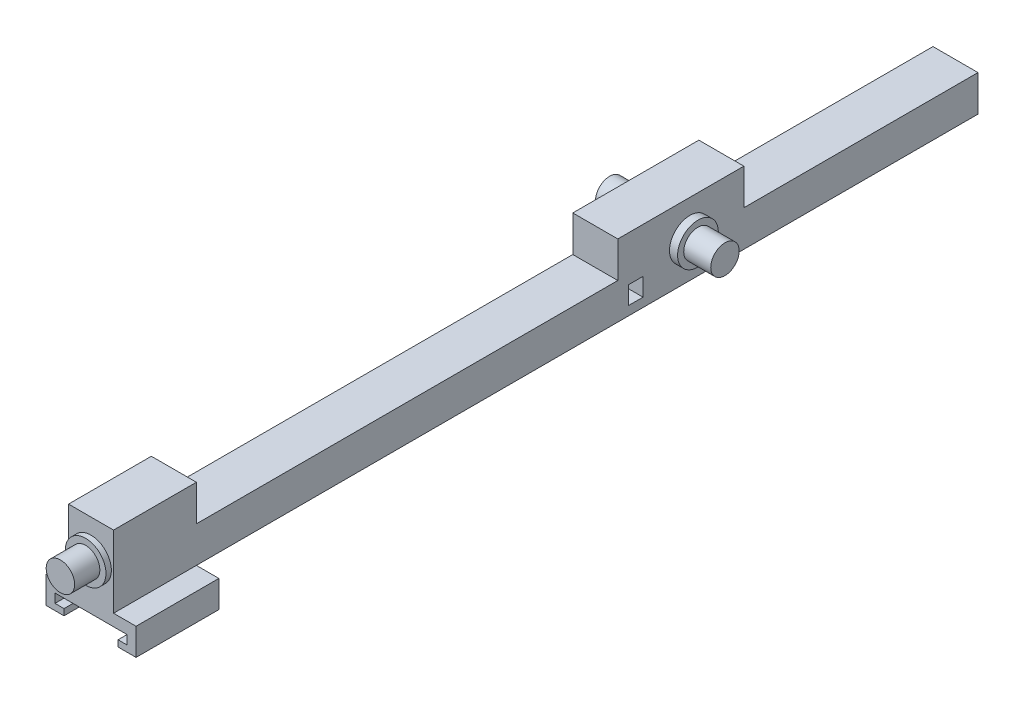
from build123d import *

# Parameters (mm, degrees)
BOSS_EXTRUDE1_DEPTH = 20
SKETCH2_R           = 5.65
BOSS_EXTRUDE2_DEPTH = 1.5
SKETCH3_R           = 3.95
BOSS_EXTRUDE3_DEPTH = 7
SKETCH4_R           = 5.65
BOSS_EXTRUDE4_DEPTH = 2.25
SKETCH5_R           = 3.95
BOSS_EXTRUDE5_DEPTH = 7.5
SKETCH9_W           = 25
SKETCH9_H           = 7.5
BOSS_EXTRUDE8_DEPTH = 23
CUT_EXTRUDE1_DEPTH  = 20
CUT_EXTRUDE2_REACH  = 173.135
SKETCH12_W          = 4
SKETCH12_H          = 5
CUT_EXTRUDE3_REACH  = 173.135
SKETCH14_W          = 65
SKETCH14_H          = 10
SKETCH14_W_2        = 117


with BuildPart() as part:
    # Sketch1 → Boss-Extrude1 (new body)
    with BuildSketch(Plane(origin=(0, 0, 0), x_dir=(1, 0, 0), z_dir=(0, 1, 0))):
        Polygon((-6.25, 80), (6.25, 80), (6.25, 0), (6.25, -160), (-6.25, -160), align=None)
    extrude(amount=BOSS_EXTRUDE1_DEPTH)

    # Sketch2 → Boss-Extrude2 (add)
    with BuildSketch(Plane.XY.offset(160)):
        with Locations((0, 10)):
            Circle(SKETCH2_R)
    extrude(amount=BOSS_EXTRUDE2_DEPTH)

    # Sketch3 → Boss-Extrude3 (add)
    with BuildSketch(Plane.XY.offset(161.5)):
        with Locations((0, 10)):
            Circle(SKETCH3_R)
    extrude(amount=BOSS_EXTRUDE3_DEPTH)

    # Sketch4 → Boss-Extrude4 (add)
    with BuildSketch(Plane.ZY.offset(6.25)):
        with Locations((0, 10)):
            Circle(SKETCH4_R)
    boss_extrude4 = extrude(amount=BOSS_EXTRUDE4_DEPTH)

    # Sketch5 → Boss-Extrude5 (add)
    with BuildSketch(Plane.ZY.offset(8.5)):
        with Locations((0, 10)):
            Circle(SKETCH5_R)
    boss_extrude5 = extrude(amount=BOSS_EXTRUDE5_DEPTH)

    # Mirror1: Boss-Extrude4, Boss-Extrude5 across plane
    add(boss_extrude4.mirror(Plane(origin=(0, 0, 0), x_dir=(0, 0, 1), z_dir=(1, 0, 0))))
    add(boss_extrude5.mirror(Plane(origin=(0, 0, 0), x_dir=(0, 0, 1), z_dir=(1, 0, 0))))

    # Sketch9 → Boss-Extrude8 (add)
    with BuildSketch(Plane.XY.offset(160)):
        with Locations((0, -3.75)):
            Rectangle(SKETCH9_W, SKETCH9_H)
    extrude(amount=-BOSS_EXTRUDE8_DEPTH)

    # Sketch10 → Cut-Extrude1 (cut)
    with BuildSketch(Plane.XY.offset(160)):
        Polygon((-10, -5.75), (-10, -3.25), (10, -3.25), (10, -5.75), (7.5, -5.75), (7.5, -7.5), (-7.5, -7.5), (-7.5, -5.75), align=None)
    extrude(amount=-CUT_EXTRUDE1_DEPTH, mode=Mode.SUBTRACT)

    # Sketch12 → Cut-Extrude2 (cut, up to next)
    with BuildSketch(Plane.ZY.offset(6.25), mode=Mode.PRIVATE) as cut_extrude2_sk1:
        with Locations((15, 5)):
            Rectangle(SKETCH12_W, SKETCH12_H)
    cut_extrude2_tool1 = extrude(cut_extrude2_sk1.sketch, amount=-CUT_EXTRUDE2_REACH, mode=Mode.PRIVATE) & part.part
    add(cut_extrude2_tool1.solids().sort_by_distance((-6.25, 5, 15))[0], mode=Mode.SUBTRACT)

    # Sketch14 → Cut-Extrude3 (cut, up to next)
    with BuildSketch(Plane.ZY.offset(6.25), mode=Mode.PRIVATE) as cut_extrude3_sk1:
        with Locations((-47.5, 15)):
            Rectangle(SKETCH14_W, SKETCH14_H)
    cut_extrude3_tool1 = extrude(cut_extrude3_sk1.sketch, amount=-CUT_EXTRUDE3_REACH, mode=Mode.PRIVATE) & part.part
    # Sketch14 → Cut-Extrude3 (cut, up to next)
    with BuildSketch(Plane.ZY.offset(6.25), mode=Mode.PRIVATE) as cut_extrude3_sk2:
        with Locations((78.5, 15)):
            Rectangle(SKETCH14_W_2, SKETCH14_H)
    cut_extrude3_tool2 = extrude(cut_extrude3_sk2.sketch, amount=-CUT_EXTRUDE3_REACH, mode=Mode.PRIVATE) & part.part
    add(cut_extrude3_tool1.solids().sort_by_distance((-6.25, 15, -47.5))[0], mode=Mode.SUBTRACT)
    add(cut_extrude3_tool2.solids().sort_by_distance((-6.25, 15, 78.5))[0], mode=Mode.SUBTRACT)


solid = part.part
